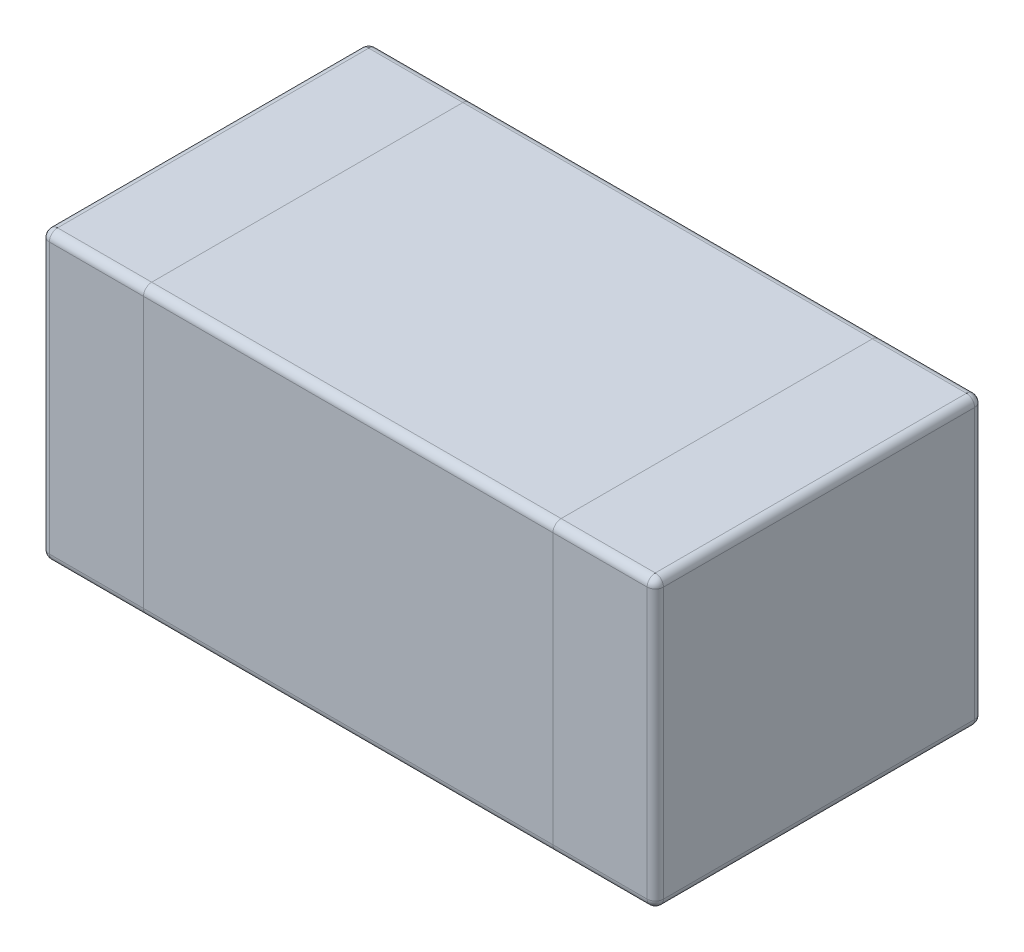
from build123d import *

# Parameters (mm, degrees)
BOSS_EXTRUDE1_DEPTH = 0.35
FILLET2_R           = 0.02


with BuildPart() as part:
    # Sketch1 → Boss-Extrude1 (new, symmetric)
    with BuildSketch(Plane(origin=(0, 0, 0), x_dir=(1, 0, 0), z_dir=(0, 1, 0))):
        with BuildLine():
            Line((-0.73, -0.4), (0.73, -0.4))
            ThreePointArc((0.73, -0.4), (0.744142136, -0.394142136), (0.75, -0.38))
            Line((0.75, -0.38), (0.75, 0.38))
            ThreePointArc((0.75, 0.38), (0.744142136, 0.394142136), (0.73, 0.4))
            Line((0.73, 0.4), (-0.73, 0.4))
            ThreePointArc((-0.73, 0.4), (-0.744142136, 0.394142136), (-0.75, 0.38))
            Line((-0.75, 0.38), (-0.75, -0.38))
            ThreePointArc((-0.75, -0.38), (-0.744142136, -0.394142136), (-0.73, -0.4))
        make_face()
    extrude(amount=BOSS_EXTRUDE1_DEPTH, both=True)

    # Fillet2
    fillet2_edges = [part.edges().sort_by_distance(p)[0] for p in [
        (0, -0.35, 0.4),
        (0, -0.35, 0.4),
        (0, -0.35, 0.4),
        (-0.744142136, -0.35, 0.394142136),
        (-0.75, -0.35, 0),
        (-0.744142136, -0.35, -0.394142136),
        (0, -0.35, -0.4),
        (0, -0.35, -0.4),
        (0, -0.35, -0.4),
        (0.744142136, -0.35, -0.394142136),
        (0.75, -0.35, 0),
        (0.744142136, -0.35, 0.394142136),
        (0, 0.35, -0.4),
        (0, 0.35, -0.4),
        (0, 0.35, -0.4),
        (0.744142136, 0.35, -0.394142136),
        (0.75, 0.35, 0),
        (0.744142136, 0.35, 0.394142136),
        (0, 0.35, 0.4),
        (0, 0.35, 0.4),
        (0, 0.35, 0.4),
        (-0.744142136, 0.35, 0.394142136),
        (-0.75, 0.35, 0),
        (-0.744142136, 0.35, -0.394142136),
    ]]
    fillet(fillet2_edges, radius=FILLET2_R)


solid = part.part
